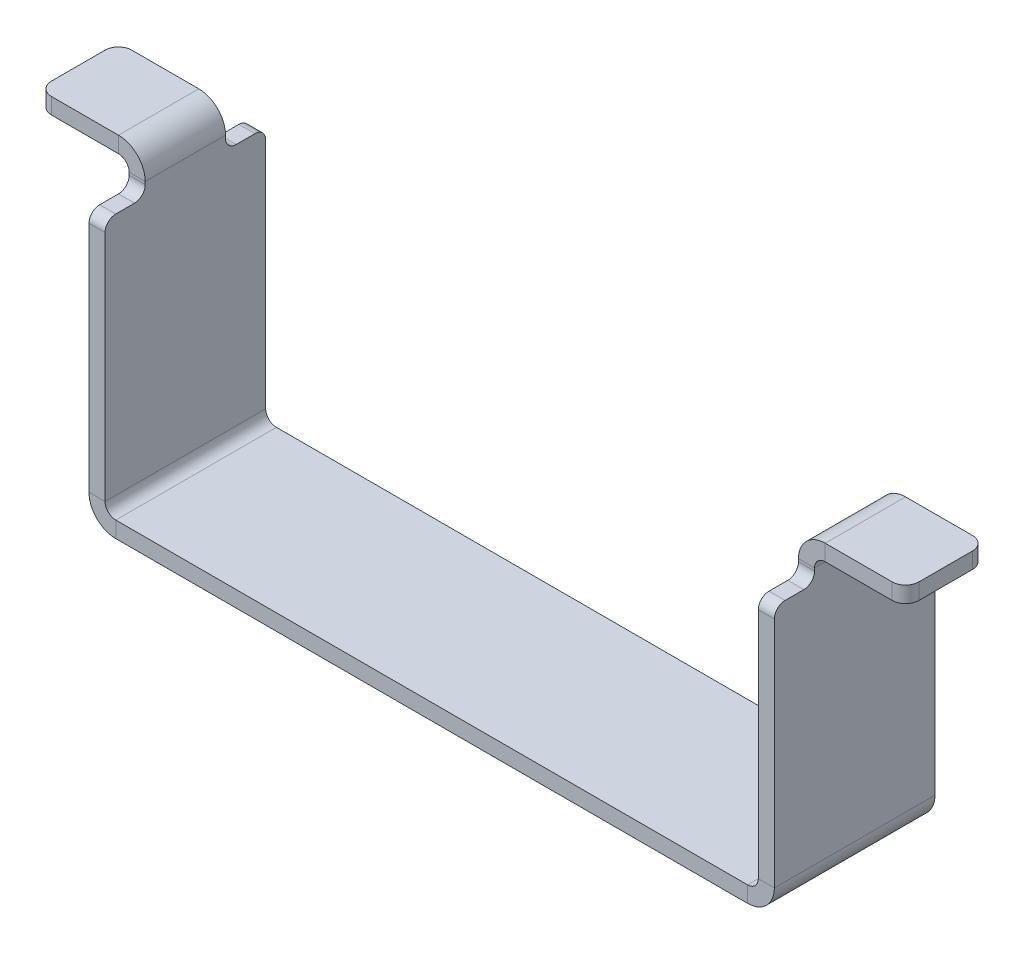
from build123d import *

# Parameters (mm, degrees)
BASE_FLANGE1_DEPTH      = 1.5
CUT_EXTRUDE1_DEPTH      = 11.07472084
CUT_EXTRUDE1_DEPTH_BACK = 11.07472084
SKETCH6_W               = 0.75
SKETCH6_H               = 3.25
FILLET1_R               = 0.2
FILLET2_R               = 0.25


# Sheet-metal steps are written as plain solids
with BuildPart() as part:
    # Sketch1 → Base-Flange1 (new, symmetric)
    with BuildSketch(Plane.XY):
        with BuildLine():
            Line((8.1, 0), (6.6, 0))
            ThreePointArc((6.6, 0), (6.246446609, -0.146446609), (6.1, -0.5))
            Line((6.1, -0.5), (6.1, -5.3))
            ThreePointArc((6.1, -5.3), (6.041421356, -5.441421356), (5.9, -5.5))
            Line((5.9, -5.5), (-5.9, -5.5))
            ThreePointArc((-5.9, -5.5), (-6.041421356, -5.441421356), (-6.1, -5.3))
            Line((-6.1, -5.3), (-6.1, -0.5))
            ThreePointArc((-6.1, -0.5), (-6.246446609, -0.146446609), (-6.6, 0))
            Line((-6.6, 0), (-8.1, 0))
            Line((-8.1, 0), (-8.1, -0.3))
            Line((-8.1, -0.3), (-6.6, -0.3))
            ThreePointArc((-6.6, -0.3), (-6.458578644, -0.358578644), (-6.4, -0.5))
            Line((-6.4, -0.5), (-6.4, -5.3))
            ThreePointArc((-6.4, -5.3), (-6.253553391, -5.653553391), (-5.9, -5.8))
            Line((-5.9, -5.8), (5.9, -5.8))
            ThreePointArc((5.9, -5.8), (6.253553391, -5.653553391), (6.4, -5.3))
            Line((6.4, -5.3), (6.4, -0.5))
            ThreePointArc((6.4, -0.5), (6.458578644, -0.358578644), (6.6, -0.3))
            Line((6.6, -0.3), (8.1, -0.3))
            Line((8.1, -0.3), (8.1, 0))
        make_face()
    extrude(amount=BASE_FLANGE1_DEPTH, both=True)

    # Sketch6 → Cut-Extrude1 (cut, two sides: drawn at the far end of the back side and taken through both)
    with BuildSketch(Plane(origin=(0, 0, 0), x_dir=(0, 0, -1), z_dir=(1, 0, 0)).offset(-CUT_EXTRUDE1_DEPTH_BACK)):
        with Locations((1.125, 0.875)):
            Rectangle(SKETCH6_W, SKETCH6_H)
        with Locations((-1.125, 0.875)):
            Rectangle(SKETCH6_W, SKETCH6_H)
    extrude(amount=CUT_EXTRUDE1_DEPTH + CUT_EXTRUDE1_DEPTH_BACK, mode=Mode.SUBTRACT)

    # Fillet1
    fillet1_edges = [part.edges().sort_by_distance(p)[0] for p in [
        (6.25, -0.75, -1.5),
        (-6.25, -0.75, -1.5),
        (6.25, -0.75, -0.75),
        (-6.25, -0.75, -0.75),
        (6.25, -0.75, 1.5),
        (-6.25, -0.75, 1.5),
        (6.25, -0.75, 0.75),
        (-6.25, -0.75, 0.75),
    ]]
    fillet(fillet1_edges, radius=FILLET1_R)

    # Fillet2
    fillet2_edges = [part.edges().sort_by_distance(p)[0] for p in [
        (-8.1, -0.15, -0.75),
        (8.1, -0.15, -0.75),
        (8.1, -0.15, 0.75),
        (-8.1, -0.15, 0.75),
    ]]
    fillet(fillet2_edges, radius=FILLET2_R)


solid = part.part
